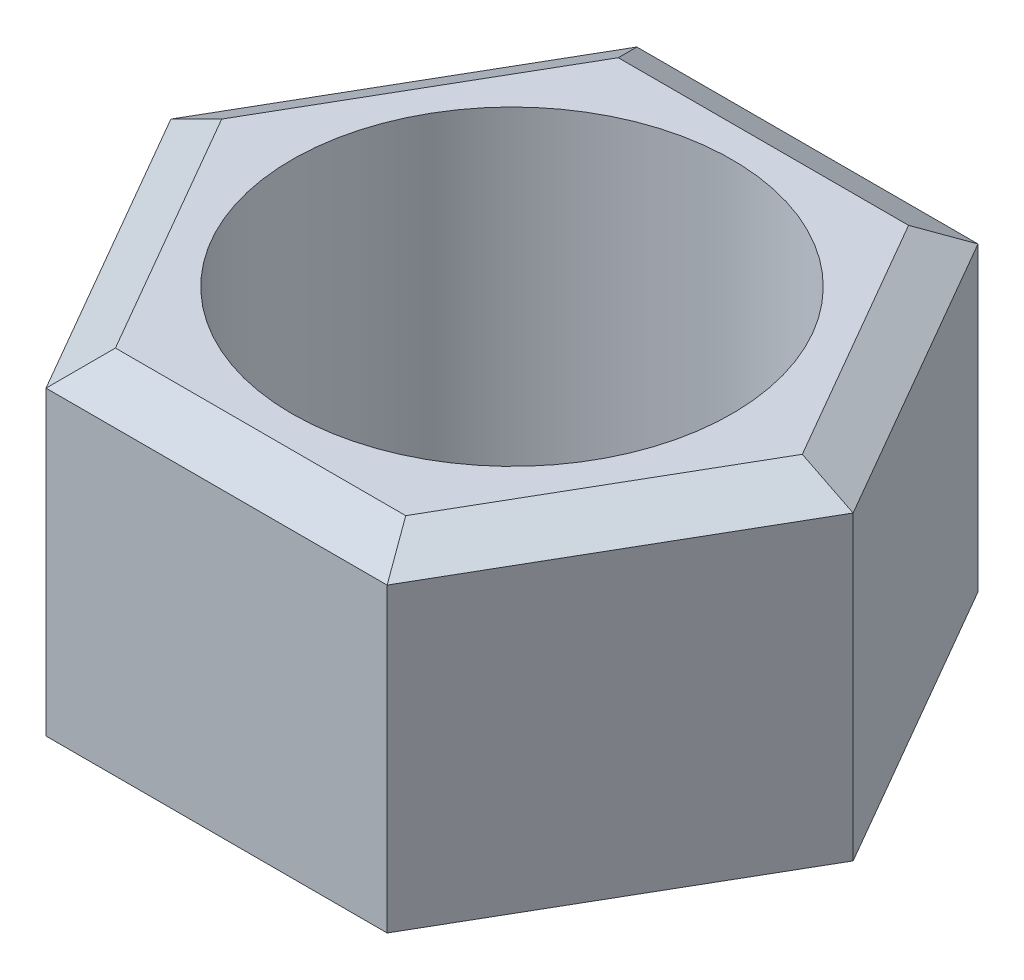
from build123d import *

# Parameters (mm, degrees)
SKETCH_1_R      = 5
EXTRUDE_1_DEPTH = 8
CHAMFER_1_SIZE  = 1
CHAMFER_1_SIZE2 = 0.577350269
CHAMFER_2_SIZE  = 1
CHAMFER_2_SIZE2 = 0.577350269


with BuildPart() as part:
    # Эскиз1 → Бобышка-Вытянуть1 (new body)
    with BuildSketch(Plane(origin=(0, 0, 0), x_dir=(1, 0, 0), z_dir=(0, 1, 0))):
        Polygon((-7.75, 0), (-3.875, -6.711696879), (3.875, -6.711696879), (7.75, 0), (3.875, 6.711696879), (-3.875, 6.711696879), align=None)
        Circle(SKETCH_1_R, mode=Mode.SUBTRACT)
    extrude(amount=EXTRUDE_1_DEPTH)

    # Фаска1
    chamfer_1_edges = [part.edges().sort_by_distance(p)[0] for p in [
        (5.8125, 8, -3.35584844),
        (0, 8, -6.711696879),
        (-5.8125, 8, -3.35584844),
        (-5.8125, 8, 3.35584844),
        (0, 8, 6.711696879),
        (5.8125, 8, 3.35584844),
    ]]
    chamfer_1_side = [part.faces().sort_by_distance(p)[0] for p in [
        (-5.634925192, 8, 3.253325576),
    ]]
    chamfer(chamfer_1_edges, length=CHAMFER_1_SIZE, length2=CHAMFER_1_SIZE2, reference=chamfer_1_side[0])

    # Фаска2
    chamfer_2_edges = [part.edges().sort_by_distance(p)[0] for p in [
        (-5.8125, 0, -3.35584844),
        (-5.8125, 0, 3.35584844),
        (0, 0, 6.711696879),
        (5.8125, 0, 3.35584844),
        (5.8125, 0, -3.35584844),
        (0, 0, -6.711696879),
    ]]
    chamfer_2_side = [part.faces().sort_by_distance(p)[0] for p in [
        (-5.634925192, 0, 3.253325576),
    ]]
    chamfer(chamfer_2_edges, length=CHAMFER_2_SIZE, length2=CHAMFER_2_SIZE2, reference=chamfer_2_side[0])


solid = part.part
